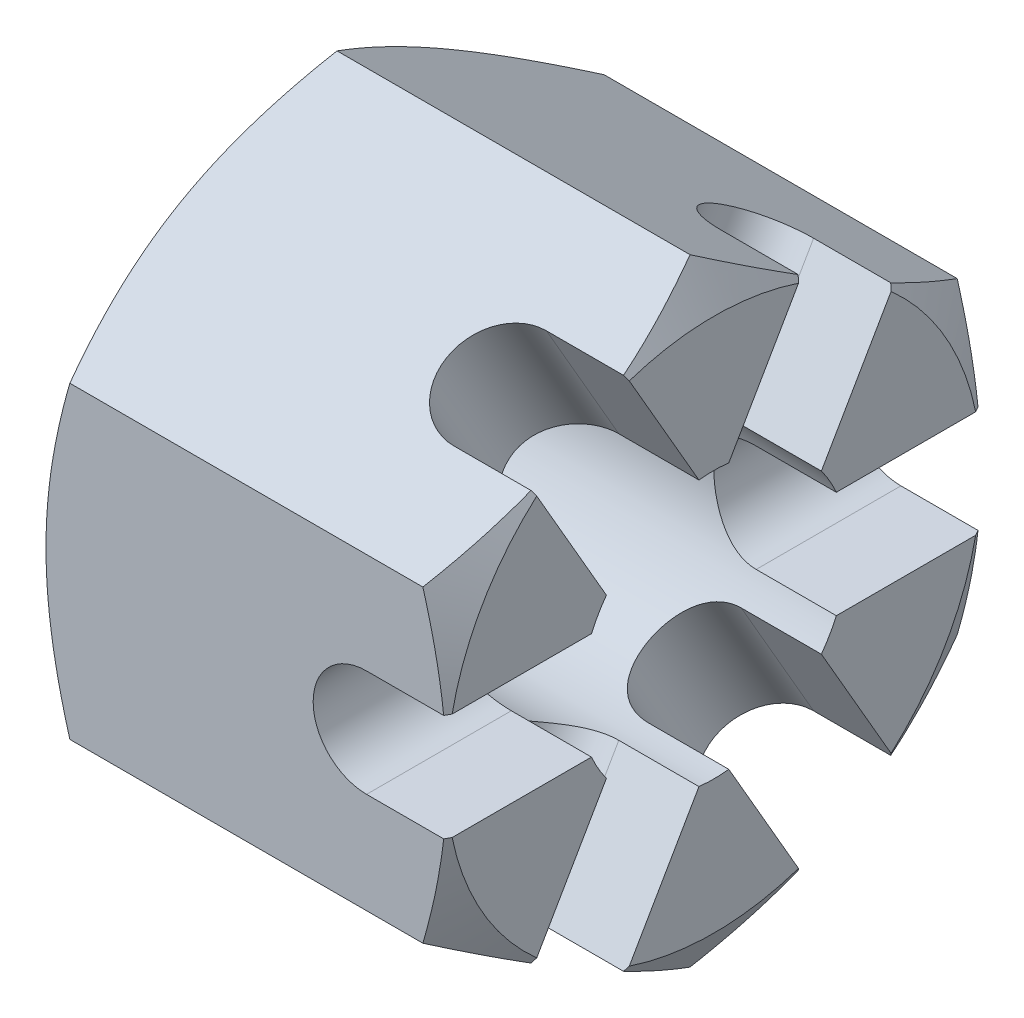
from build123d import *

# Parameters (mm, degrees)
SKETCH1_R          = 2.5
EXTRUDE1_DEPTH     = 3.75
CUT_EXTRUDE2_DEPTH = 9.508574107
CIRPATTERN1_COUNT  = 3


# Read off the part's stored shape, not the designer's step: Cut-Extrude1
with BuildPart() as part:
    # Sketch1 → Extrude1 (new, symmetric)
    with BuildSketch(Plane(origin=(0, 0, 0), x_dir=(0, 0, -1), z_dir=(1, 0, 0))):
        Polygon((5, 2.886751346), (0, 5.773502692), (-5, 2.886751346), (-5, -2.886751346), (0, -5.773502692), (5, -2.886751346), align=None)
        Circle(SKETCH1_R, mode=Mode.SUBTRACT)
    extrude(amount=EXTRUDE1_DEPTH, both=True)

    # Sketch3 → Cut-Extrude2 (cut, symmetric)
    with BuildSketch(Plane.XY):
        with BuildLine():
            Line((3.75, -1), (2.25, -1))
            ThreePointArc((2.25, -1), (1.25, 0), (2.25, 1))
            Line((2.25, 1), (3.75, 1))
            ThreePointArc((3.75, 1), (4.75, 0), (3.75, -1))
        make_face()
    cut_extrude2 = extrude(amount=CUT_EXTRUDE2_DEPTH, both=True, mode=Mode.SUBTRACT)

    # CirPattern1: Cut-Extrude2 ×3 about axis
    cirpattern1_axis = Axis((0, 0, 0), (1, 0, 0))
    for i in range(1, CIRPATTERN1_COUNT):
        add(cut_extrude2.rotate(cirpattern1_axis, i * 360 / CIRPATTERN1_COUNT), mode=Mode.SUBTRACT)

    # Cut-Extrude1 outline → Cut-Extrude1 (revolve, cut)
    with BuildSketch(Plane.YX):
        Polygon((5.773502692, -3.303418013), (4.999998537, -3.750000845), (5.773502692, -3.750000845), align=None)
    cut_extrude1 = revolve(axis=Axis((0, 0, 0), (1, 0, 0)), mode=Mode.SUBTRACT)

    # Mirror1: Cut-Extrude1 across plane
    add(cut_extrude1.mirror(Plane(origin=(0, 0, 0), x_dir=(0, 0, 1), z_dir=(1, 0, 0))), mode=Mode.SUBTRACT)


solid = part.part
